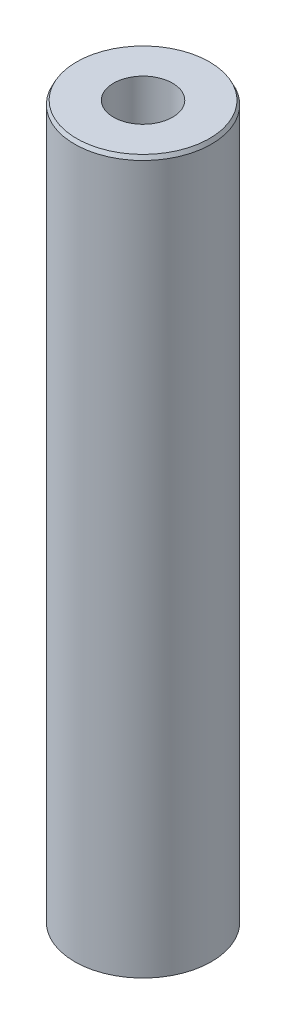
from build123d import *
from OCP.BRepFilletAPI import BRepFilletAPI_MakeChamfer

# Parameters (mm, degrees)
SKETCH1_R           = 57.5
BOSS_EXTRUDE1_DEPTH = 600
SKETCH2_R           = 24.823527628
CUT_EXTRUDE1_DEPTH  = 606.485342515
CHAMFER1_SIZE       = 3.27197159
CHAMFER1_SIZE2      = 1.659945582


with BuildPart() as part:
    # Sketch1 → Boss-Extrude1 (new body)
    with BuildSketch(Plane(origin=(0, 0, 0), x_dir=(1, 0, 0), z_dir=(0, 1, 0))):
        Circle(SKETCH1_R)
    extrude(amount=BOSS_EXTRUDE1_DEPTH)

    # Sketch2 → Cut-Extrude1 (cut, through all)
    with BuildSketch(Plane(origin=(0, 0, 0), x_dir=(1, 0, 0), z_dir=(0, 1, 0))):
        Circle(SKETCH2_R)
    extrude(amount=CUT_EXTRUDE1_DEPTH, mode=Mode.SUBTRACT)

    # Chamfer1: one chamfer whose edges measure the first distance from different faces: ONE call of the kernel's chamfer builder (chamfer() names one face for all edges)
    chamfer1_edges_1 = [part.edges().sort_by_distance(p)[0] for p in [
        (-57.5, 600, 0),
    ]]
    chamfer1_side_1 = [part.faces().sort_by_distance(p)[0] for p in [
        (-57.5, 300, 0),
    ]]
    chamfer1_edges_2 = [part.edges().sort_by_distance(p)[0] for p in [
        (-57.5, 0, 0),
    ]]
    chamfer1_side_2 = [part.faces().sort_by_distance(p)[0] for p in [
        (-55.873654403, 0, 0),
    ]]
    chamfer1 = BRepFilletAPI_MakeChamfer(part.part.solid().wrapped)
    for e in chamfer1_edges_1:
        chamfer1.Add(CHAMFER1_SIZE, CHAMFER1_SIZE2, e.wrapped, chamfer1_side_1[0].wrapped)  # the first distance lies on this face
    for e in chamfer1_edges_2:
        chamfer1.Add(CHAMFER1_SIZE, CHAMFER1_SIZE2, e.wrapped, chamfer1_side_2[0].wrapped)  # the first distance lies on this face
    add(Compound.cast(chamfer1.Shape()), mode=Mode.REPLACE)


solid = part.part
